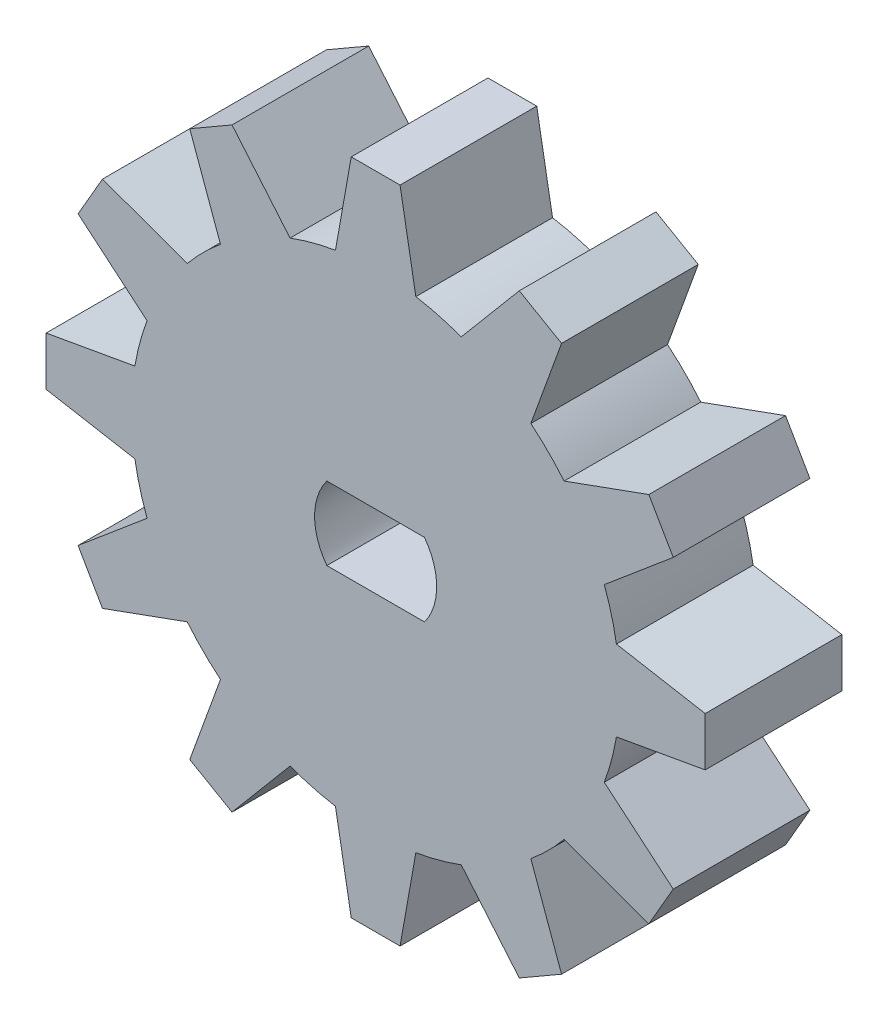
from build123d import *

# Parameters (mm, degrees)
SKETCH1_R           = 10
BOSS_EXTRUDE1_DEPTH = 5.6
BOSS_EXTRUDE2_DEPTH = 5.6
CIRPATTERN1_COUNT   = 12
CUT_EXTRUDE1_DEPTH  = 7


with BuildPart() as part:
    # Sketch1 → Boss-Extrude1 (new body)
    with BuildSketch(Plane.XY):
        Circle(SKETCH1_R)
    extrude(amount=BOSS_EXTRUDE1_DEPTH)

    # Sketch3 → Boss-Extrude2 (add)
    with BuildSketch(Plane.XY):
        Polygon((-1, 13.5), (1, 13.5), (1.8, 9), (-1.8, 9), align=None)
    boss_extrude2 = extrude(amount=BOSS_EXTRUDE2_DEPTH)

    # CirPattern1: Boss-Extrude2 ×12 about axis
    cirpattern1_axis = Axis((0, 0, 0), (0, 0, 1))
    for i in range(1, CIRPATTERN1_COUNT):
        add(boss_extrude2.rotate(cirpattern1_axis, i * 360 / CIRPATTERN1_COUNT))

    # Sketch4 → Cut-Extrude1 (cut)
    with BuildSketch(Plane.XY):
        with BuildLine():
            Line((-2, -1.5), (2, -1.5))
            ThreePointArc((2, -1.5), (2.5, 0), (2, 1.5))
            Line((2, 1.5), (-2, 1.5))
            ThreePointArc((-2, 1.5), (-2.5, 0), (-2, -1.5))
        make_face()
    extrude(amount=CUT_EXTRUDE1_DEPTH, mode=Mode.SUBTRACT)


solid = part.part
